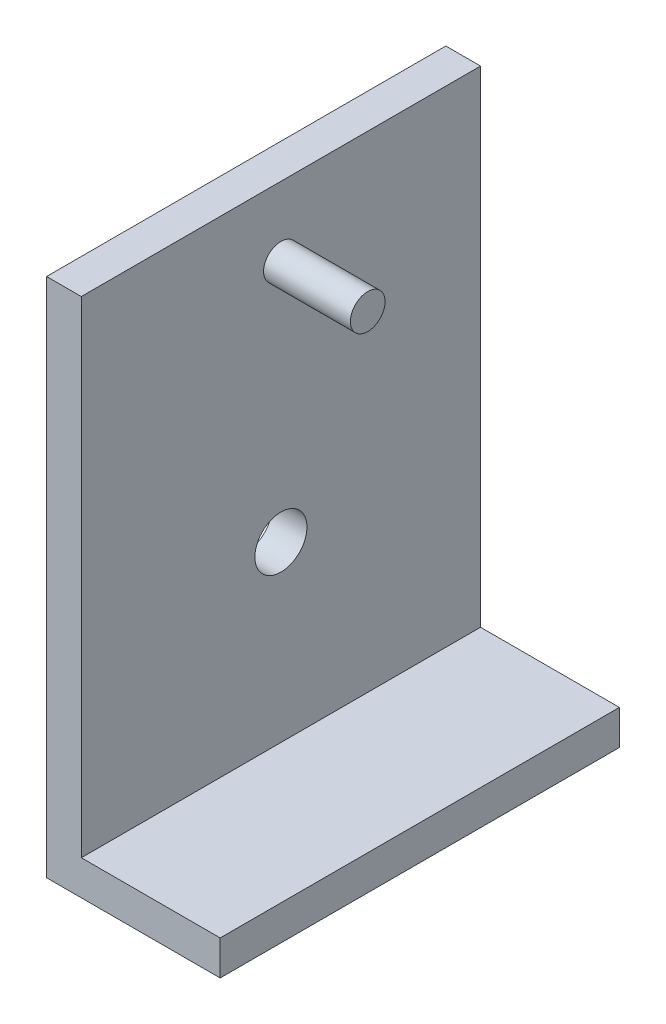
from build123d import *

# Parameters (mm, degrees)
BOSS_EXTRUDE1_DEPTH = 57.5
SKETCH2_R           = 7.5
CUT_EXTRUDE1_DEPTH  = 169.244613584
SKETCH3_R           = 5
BOSS_EXTRUDE2_DEPTH = 25


with BuildPart() as part:
    # Sketch1 → Boss-Extrude1 (new, symmetric)
    with BuildSketch(Plane.XY):
        Polygon((0, 150), (0, 0), (50, 0), (50, 10), (10, 10), (10, 150), align=None)
    extrude(amount=BOSS_EXTRUDE1_DEPTH, both=True)

    # Sketch2 → Cut-Extrude1 (cut, through all)
    with BuildSketch(Plane.ZY):
        with Locations((0, 60)):
            Circle(SKETCH2_R)
    extrude(amount=-CUT_EXTRUDE1_DEPTH, mode=Mode.SUBTRACT)

    # Sketch3 → Boss-Extrude2 (add)
    with BuildSketch(Plane(origin=(10, 0, 0), x_dir=(0, 0, -1), z_dir=(1, 0, 0))):
        with Locations((0, 130)):
            Circle(SKETCH3_R)
    extrude(amount=BOSS_EXTRUDE2_DEPTH)


solid = part.part
